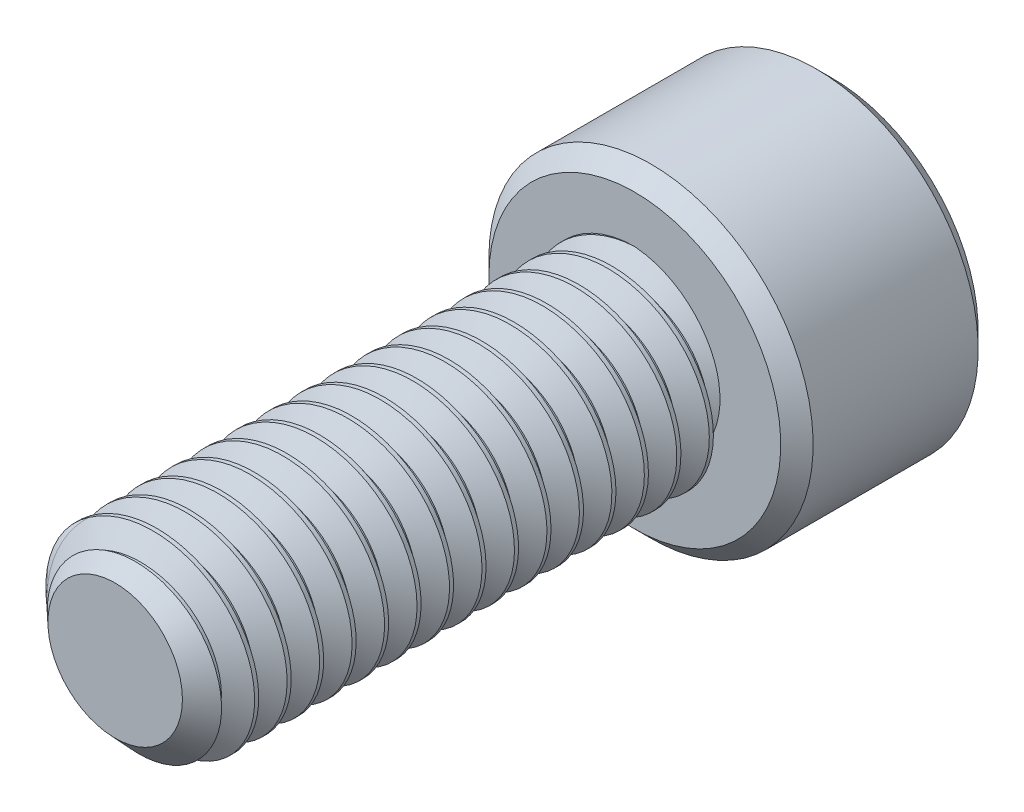
from build123d import *

# Parameters (mm, degrees)
SKETCH1_R          = 2.413
EXTRUDE1_DEPTH     = 12.7
CUT_SWEEP1_PITCH   = 0.79375
SKETCH6_R          = 3.9624
EXTRUDE2_DEPTH     = 4.826
CUT_EXTRUDE1_DEPTH = 2.9765625
CHAMFER1_SIZE      = 0.39624


with BuildPart() as part:
    # Sketch1 → Extrude1 (new body)
    with BuildSketch(Plane.XY):
        Circle(SKETCH1_R)
    extrude(amount=-EXTRUDE1_DEPTH)

    # Cut-Sweep1: arcs per turn and ends read off the stored shape
    # Cut-Sweep1: the profile of Sketch3 profile screwed along a right-hand helix through 19 turns, 6 arcs to a turn; built about Z, then put on its axis
    cut_sweep1_z = Axis((0, 0, 0), (0, 0, 1))
    cut_sweep1_corners = [(2.4133, 0, -1.488454455), (1.897444252, 0, -1.190625), (1.897444252, 0, -1.09140625), (2.4133, 0, -0.793576795)]
    with BuildLine(mode=Mode.PRIVATE) as cut_sweep1_profile:
        Line(cut_sweep1_corners[0], cut_sweep1_corners[1])
        Line(cut_sweep1_corners[1], cut_sweep1_corners[2])
        Line(cut_sweep1_corners[2], cut_sweep1_corners[3])
        Line(cut_sweep1_corners[3], cut_sweep1_corners[0])
    cut_sweep1_cap = Face(cut_sweep1_profile.wire())
    cut_sweep1_turn_angles = [0, 30, 60, 90, 120, 150, 180, 210, 240, 270, 300, 330, 360]
    cut_sweep1_turn_weights = [1, 0.8660254037844387, 1, 0.8660254037844387, 1, 0.8660254037844387, 1, 0.8660254037844387, 1, 0.8660254037844387, 1, 0.8660254037844387, 1]
    cut_sweep1_turn_rails = [Edge.make_bspline([Vector(p[0], p[1], 0).rotate(cut_sweep1_z, cut_sweep1_turn_angles[k]) / cut_sweep1_turn_weights[k] + Vector(0, 0, p[2] + CUT_SWEEP1_PITCH * cut_sweep1_turn_angles[k] / 360) for k in range(13)], [0, 0, 0, 1, 1, 2, 2, 3, 3, 4, 4, 5, 5, 6, 6, 6], 2, cut_sweep1_turn_weights) for p in cut_sweep1_corners]
    cut_sweep1_turn_sides = [Face.make_surface_from_curves(cut_sweep1_turn_rails[p[0]], cut_sweep1_turn_rails[p[1]]) for p in [(0, 1), (1, 2), (2, 3), (3, 0)]]
    cut_sweep1 = Plane(origin=(0, 0, 0), x_dir=(0, 1, 0), z_dir=(0, 0, -1)) * Solid(Shell([*[p.moved(Location((0, 0, CUT_SWEEP1_PITCH * i))) for i in range(19) for p in cut_sweep1_turn_sides], cut_sweep1_cap, cut_sweep1_cap.rotate(cut_sweep1_z, 6840).moved(Location((0, 0, CUT_SWEEP1_PITCH * 6840 / 360)))]))
    add(cut_sweep1, mode=Mode.SUBTRACT)

    # Sketch4 → Cut-Revolve1 (revolve, cut)
    with BuildSketch(Plane(origin=(0, 0, 0), x_dir=(0, 0, -1), z_dir=(1, 0, 0)), mode=Mode.PRIVATE) as cut_revolve1_sk:
        Polygon((0.717622345, 2.413), (0, 1.643444252), (0, 2.413), align=None)
    revolve(cut_revolve1_sk.sketch.rotate(Axis((0, 0, 0), (0, 0, -1)), 280.052289154), axis=Axis((0, 0, 0), (0, 0, -1)), mode=Mode.SUBTRACT)

    # Sketch6 → Extrude2 (add)
    with BuildSketch(Plane(origin=(0, 0, -12.7), x_dir=(-1, 0, 0), z_dir=(0, 0, -1))):
        Circle(SKETCH6_R)
    extrude(amount=EXTRUDE2_DEPTH)

    # Sketch7 → Cut-Extrude1 (cut)
    with BuildSketch(Plane(origin=(0, 0, -17.526), x_dir=(-1, 0, 0), z_dir=(0, 0, -1))):
        Polygon((0, 2.291358881), (-1.984375, 1.14567944), (-1.984375, -1.14567944), (0, -2.291358881), (1.984375, -1.14567944), (1.984375, 1.14567944), align=None)
    extrude(amount=-CUT_EXTRUDE1_DEPTH, mode=Mode.SUBTRACT)

    # Cut-Extrude2 cone 1 section (through the dimple's axis) → Cut-Extrude2 (revolve, cut)
    with BuildSketch(Plane(origin=(0, 0, -17.526), x_dir=(0, 1, 0), z_dir=(1, 0, 0))):
        Polygon((0, 0), (2.291358881, 0), (0, 2.291358881), align=None)
    revolve(axis=Axis((0, 0, -17.526), (0, 0, 1)), mode=Mode.SUBTRACT)

    # Chamfer1
    chamfer1_edges = [part.edges().sort_by_distance(p)[0] for p in [
        (3.9624, 0, -12.7),
        (3.9624, 0, -17.526),
    ]]
    chamfer(chamfer1_edges, length=CHAMFER1_SIZE)


solid = part.part
